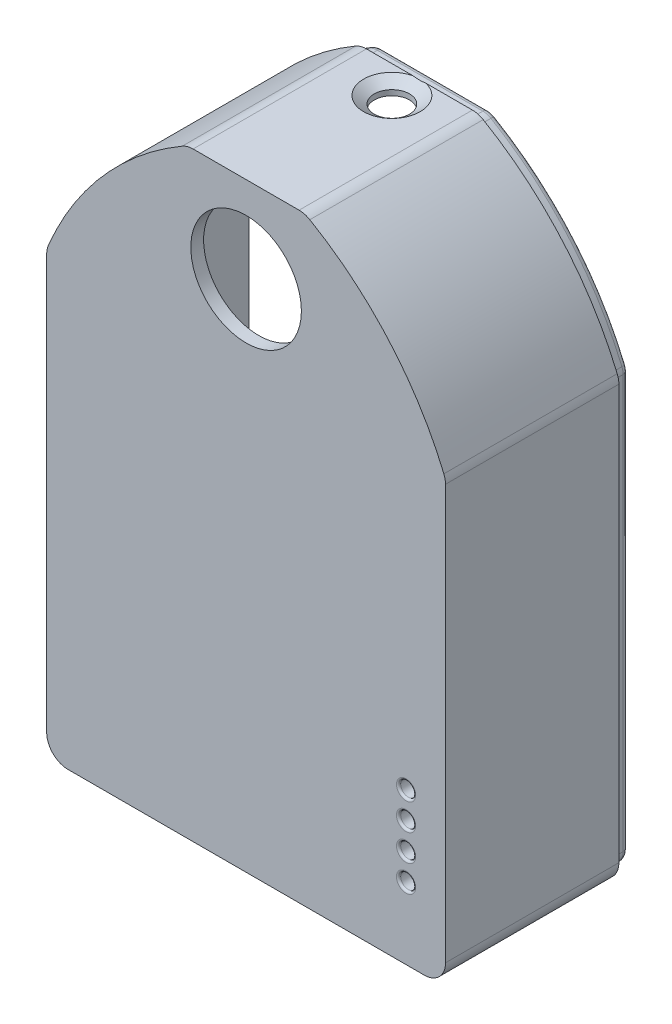
from build123d import *

# Parameters (mm, degrees)
SKETCH1_R             = 4.65
SKETCH1_R_2           = 1.85
EXTRUDE_THIN1_DEPTH   = 5
EXTRUDE_THIN1_2_DEPTH = 5
SKETCH1_R_3           = 3.9
SKETCH1_R_4           = 1.1
EXTRUDE_THIN1_3_DEPTH = 5
EXTRUDE_THIN1_4_DEPTH = 5
SKETCH3_R             = 4.65
SKETCH3_R_2           = 1.85
BOSS_EXTRUDE2_DEPTH   = 2.4
EXTRUDE_THIN2_START   = 30.11
EXTRUDE_THIN2_DEPTH   = 30.11
SKETCH5_R             = 10.368943179
CUT_EXTRUDE1_DEPTH    = 2.4
EXTRUDE_THIN3_START   = 3
EXTRUDE_THIN3_DEPTH   = 3
SKETCH7_W             = 9.762882659
SKETCH7_H             = 5.328585572
CUT_EXTRUDE2_DEPTH    = 2.4
SKETCH10_W            = 3.38269226
SKETCH10_H            = 1.73163863
SKETCH10_H_2          = 0.8
SKETCH10_H_3          = 1.731638631
CUT_EXTRUDE4_DEPTH    = 2.4
SKETCH11_R            = 1.4
CUT_EXTRUDE5_DEPTH    = 2.4
FILLET2_R             = 0.4
FILLET3_R             = 2
SKETCH12_R            = 3.3
CUT_EXTRUDE6_DEPTH    = 2.4
CHAMFER1_SIZE         = 2
CHAMFER1_SIZE_2       = 1.400415076
FILLET4_R             = 4
FILLET5_R             = 3
FILLET6_R             = 1


with BuildPart() as part:
    # Sketch1 → Extrude-Thin1 (new body)
    with BuildSketch(Plane.XY):
        with Locations((-22.941659, 27.553447)):
            Circle(SKETCH1_R)
        with Locations((-22.941659, 27.553447)):
            Circle(SKETCH1_R_2, mode=Mode.SUBTRACT)
    extrude(amount=EXTRUDE_THIN1_DEPTH)



with BuildPart() as body_2:
    # Sketch1 → Extrude-Thin1 2 (new body)
    with BuildSketch(Plane.XY):
        with Locations((-22.941659, -28.056553)):
            Circle(SKETCH1_R)
        with Locations((-22.941659, -28.056553)):
            Circle(SKETCH1_R_2, mode=Mode.SUBTRACT)
    extrude(amount=EXTRUDE_THIN1_2_DEPTH)


with BuildPart() as body_3:
    # Sketch1 → Extrude-Thin1 3 (new body)
    with BuildSketch(Plane.XY):
        with Locations((30, 35.5)):
            Circle(SKETCH1_R_3)
        with Locations((30, 35.5)):
            Circle(SKETCH1_R_4, mode=Mode.SUBTRACT)
    extrude(amount=EXTRUDE_THIN1_3_DEPTH)


with BuildPart() as body_4:
    # Sketch1 → Extrude-Thin1 4 (new body)
    with BuildSketch(Plane.XY):
        with Locations((30, -35.5)):
            Circle(SKETCH1_R_3)
        with Locations((30, -35.5)):
            Circle(SKETCH1_R_4, mode=Mode.SUBTRACT)
    extrude(amount=EXTRUDE_THIN1_4_DEPTH)


with BuildPart() as part_1:
    add(part.part)

    add(body_2.part)  # Boss-Extrude2 merges body 2

    add(body_3.part)  # Boss-Extrude2 merges body 3

    add(body_4.part)  # Boss-Extrude2 merges body 4
    # Sketch3 → Boss-Extrude2 (add)
    # profile 1 of 3: a face of its own
    with BuildSketch(Plane.XY.offset(5)):
        with BuildLine():
            Line((-37.4, 40.61), (-37.4, -41.9))
            Line((-37.4, -41.9), (37.4, -41.9))
            Line((37.4, -41.9), (37.4, 40.61))
            ThreePointArc((37.4, 40.61), (26.770998902, 57.872479034), (11, 70.61))
            Line((11, 70.61), (-11, 70.61))
            ThreePointArc((-11, 70.61), (-26.770998902, 57.872479034), (-37.4, 40.61))
        make_face()
        with Locations((-22.941659, 27.553447)):
            Circle(SKETCH3_R, mode=Mode.SUBTRACT)
    # profile 2 of 3: a face of its own
    with BuildSketch(Plane.XY.offset(5)):
        with Locations((-22.941659, 27.553447)):
            Circle(SKETCH3_R)
        with Locations((-22.941659, 27.553447)):
            Circle(SKETCH3_R_2, mode=Mode.SUBTRACT)
    # profile 3 of 3: a face of its own
    with BuildSketch(Plane.XY.offset(5)):
        with Locations((-22.941659, 27.553447)):
            Circle(SKETCH3_R_2)
    extrude(amount=BOSS_EXTRUDE2_DEPTH)

    # Sketch4 → Extrude-Thin2 (add)
    with BuildSketch(Plane(origin=(0, 0, 5), x_dir=(-1, 0, 0), z_dir=(0, 0, -1)).offset(EXTRUDE_THIN2_START)):
        with BuildLine():
            Line((-37.4, 40.61), (-37.4, -41.9))
            Line((-37.4, -41.9), (37.4, -41.9))
            Line((37.4, -41.9), (37.4, 40.61))
            ThreePointArc((37.4, 40.61), (26.770998902, 57.872479034), (11, 70.61))
            Line((11, 70.61), (-11, 70.61))
            ThreePointArc((-11, 70.61), (-26.770998902, 57.872479034), (-37.4, 40.61))
        make_face()
        with BuildLine():
            Line((-35, 40.140832689), (-35, -39.5))
            Line((-35, -39.5), (35, -39.5))
            Line((35, -39.5), (35, 40.140832689))
            ThreePointArc((35, 40.140832689), (25.021938672, 56.227056431), (10.36801887, 68.21))
            Line((10.36801887, 68.21), (-10.36801887, 68.21))
            ThreePointArc((-10.36801887, 68.21), (-25.021938672, 56.227056431), (-35, 40.140832689))
        make_face(mode=Mode.SUBTRACT)
    extrude(amount=-EXTRUDE_THIN2_DEPTH)

    # Sketch5 → Cut-Extrude1 (cut)
    with BuildSketch(Plane.XY.offset(7.4)):
        with Locations((0, 54.431088118)):
            Circle(SKETCH5_R)
    extrude(amount=-CUT_EXTRUDE1_DEPTH, mode=Mode.SUBTRACT)

    # Sketch6 → Extrude-Thin3 (add)
    with BuildSketch(Plane(origin=(0, 0, -25.11), x_dir=(-1, 0, 0), z_dir=(0, 0, -1)).offset(EXTRUDE_THIN3_START)):
        with BuildLine():
            Line((-10.685733563, 69.41), (10.685733563, 69.41))
            ThreePointArc((10.685733563, 69.41), (25.896594663, 57.049645838), (36.2, 40.376659037))
            Line((36.2, 40.376659037), (36.2, -40.7))
            Line((36.2, -40.7), (-36.2, -40.7))
            Line((-36.2, -40.7), (-36.2, 40.376659037))
            ThreePointArc((-36.2, 40.376659037), (-25.896594663, 57.049645838), (-10.685733563, 69.41))
        make_face()
        with BuildLine():
            Line((-10.36801887, 68.21), (10.36801887, 68.21))
            ThreePointArc((10.36801887, 68.21), (25.021938672, 56.227056431), (35, 40.140832689))
            Line((35, 40.140832689), (35, -39.5))
            Line((35, -39.5), (-35, -39.5))
            Line((-35, -39.5), (-35, 40.140832689))
            ThreePointArc((-35, 40.140832689), (-25.021938672, 56.227056431), (-10.36801887, 68.21))
        make_face(mode=Mode.SUBTRACT)
    extrude(amount=-EXTRUDE_THIN3_DEPTH)

    # Sketch7 → Cut-Extrude2 (cut)
    with BuildSketch(Plane.XZ.offset(41.9)):
        with Locations((-1.153377644, -4.974292786)):
            Rectangle(SKETCH7_W, SKETCH7_H)
        with BuildLine():
            Line((18, -0.615), (21.22, -0.615))
            ThreePointArc((21.22, -0.615), (22.669568901, -0.014568901), (23.27, 1.435))
            Line((23.27, 1.435), (23.27, 2.095))
            ThreePointArc((23.27, 2.095), (22.669568901, 3.544568901), (21.22, 4.145))
            Line((21.22, 4.145), (18, 4.145))
            Line((18, 4.145), (14.78, 4.145))
            ThreePointArc((14.78, 4.145), (13.330431099, 3.544568901), (12.73, 2.095))
            Line((12.73, 2.095), (12.73, 1.435))
            ThreePointArc((12.73, 1.435), (13.330431099, -0.014568901), (14.78, -0.615))
            Line((14.78, -0.615), (18, -0.615))
        make_face()
    extrude(amount=-CUT_EXTRUDE2_DEPTH, mode=Mode.SUBTRACT)

    # Sketch10 → Cut-Extrude4 (cut)
    with BuildSketch(Plane.ZY.offset(37.4)):
        with Locations((1.49365387, -0.852542054)):
            Rectangle(SKETCH10_W, SKETCH10_H)
        with Locations((1.49365387, -3.118361369)):
            Rectangle(SKETCH10_W, SKETCH10_H_2)
        with Locations((1.49365387, -3.918361369)):
            Rectangle(SKETCH10_W, SKETCH10_H_2)
        with Locations((1.49365387, -6.184180685)):
            Rectangle(SKETCH10_W, SKETCH10_H_3)
    extrude(amount=-CUT_EXTRUDE4_DEPTH, mode=Mode.SUBTRACT)

    # Sketch11 → Cut-Extrude5 (cut)
    with BuildSketch(Plane.XY.offset(7.4)):
        with Locations((30, -28.5)):
            Circle(SKETCH11_R)
        with Locations((30, -23.5)):
            Circle(SKETCH11_R)
        with Locations((30, -18.5)):
            Circle(SKETCH11_R)
        with Locations((30, -13.5)):
            Circle(SKETCH11_R)
    extrude(amount=-CUT_EXTRUDE5_DEPTH, mode=Mode.SUBTRACT)

    # Fillet2
    fillet2_edges = [part_1.edges().sort_by_distance(p)[0] for p in [
        (-37.4, -0.852542054, -0.19769226),
        (-36.2, -1.718361369, -0.19769226),
        (-37.4, 0.013277261, 1.49365387),
        (-36.2, 0.013277261, -0.19769226),
        (-35, -0.852542054, 3.185),
        (-36.2, 0.013277261, 3.185),
        (-35, -1.718361369, 1.49365387),
        (-36.2, -1.718361369, 3.185),
        (-35, -0.852542054, -0.19769226),
        (-35, 0.013277261, 1.49365387),
        (-37.4, -1.718361369, 1.49365387),
        (-37.4, -0.852542054, 3.185),
        (-37.4, -3.518361369, -0.19769226),
        (-36.2, -4.318361369, -0.19769226),
        (-37.4, -2.718361369, 1.49365387),
        (-36.2, -2.718361369, -0.19769226),
        (-35, -3.518361369, 3.185),
        (-36.2, -2.718361369, 3.185),
        (-35, -4.318361369, 1.49365387),
        (-36.2, -4.318361369, 3.185),
        (-35, -3.518361369, -0.19769226),
        (-35, -2.718361369, 1.49365387),
        (-37.4, -4.318361369, 1.49365387),
        (-37.4, -3.518361369, 3.185),
        (-37.4, -5.318361369, 1.49365387),
        (-36.2, -5.318361369, -0.19769226),
        (-35, -6.184180685, 3.185),
        (-36.2, -5.318361369, 3.185),
        (-35, -7.05, 1.49365387),
        (-36.2, -7.05, 3.185),
        (-37.4, -6.184180685, -0.19769226),
        (-36.2, -7.05, -0.19769226),
        (-35, -5.318361369, 1.49365387),
        (-35, -6.184180685, -0.19769226),
        (-37.4, -7.05, 1.49365387),
        (-37.4, -6.184180685, 3.185),
        (28.6, -28.5, 7.4),
        (28.6, -23.5, 7.4),
        (28.6, -18.5, 7.4),
        (28.6, -13.5, 7.4),
    ]]
    fillet(fillet2_edges, radius=FILLET2_R)

    # Fillet3
    fillet3_edges = [part_1.edges().sort_by_distance(p)[0] for p in [
        (-6.034818974, -41.9, -4.974292786),
        (-1.153377645, -41.9, -7.638585572),
        (3.728063685, -41.9, -4.974292786),
        (-1.153377645, -41.9, -2.31),
        (13.330431099, -41.9, -0.014568901),
        (18, -41.9, -0.615),
        (22.669568901, -41.9, -0.014568901),
        (23.27, -41.9, 1.765),
        (22.669568901, -41.9, 3.544568901),
        (18, -41.9, 4.145),
        (13.330431099, -41.9, 3.544568901),
        (12.73, -41.9, 1.765),
    ]]
    fillet(fillet3_edges, radius=FILLET3_R)

    # Sketch12 → Cut-Extrude6 (cut)
    with BuildSketch(Plane(origin=(0, 70.61, 0), x_dir=(1, 0, 0), z_dir=(0, 1, 0))):
        with Locations(Location((0, 19.945, 0), (0, 0, 180))):
            Circle(SKETCH12_R)
    extrude(amount=-CUT_EXTRUDE6_DEPTH, mode=Mode.SUBTRACT)

    # Chamfer1
    # the kernel refuses this chamfer: 2, 1.400415076 mm, written as the material it takes off along each edge
    with BuildSketch(Plane(origin=(0, 70.61, -19.945), x_dir=(-1, 0, 0), z_dir=(0, 0, -1))) as chamfer1_piece_1:
        Polygon((3.3 + CHAMFER1_SIZE, 0), (3.3, -CHAMFER1_SIZE_2), (3.3, 0), align=None)
    revolve(axis=Axis((0, 70.61, -19.945), (0, 1, 0)), mode=Mode.SUBTRACT)

    # Fillet4
    fillet4_edges = [part_1.edges().sort_by_distance(p)[0] for p in [
        (37.4, -41.9, -8.855),
        (37.4, 40.61, -8.855),
        (11, 70.61, -8.855),
        (-11, 70.61, -8.855),
        (-37.4, 40.61, -8.855),
        (-37.4, -41.9, -8.855),
    ]]
    fillet(fillet4_edges, radius=FILLET4_R)

    # Fillet5
    fillet5_edges = [part_1.edges().sort_by_distance(p)[0] for p in [
        (-36.2, -40.7, -26.61),
        (-36.2, 40.376659037, -26.61),
        (-10.685733563, 69.41, -26.61),
        (10.685733563, 69.41, -26.61),
        (36.2, 40.376659037, -26.61),
        (36.2, -40.7, -26.61),
    ]]
    fillet(fillet5_edges, radius=FILLET5_R)

    # Fillet6
    # the kernel refuses this fillet: 1 mm, written as the material it takes off along each edge
    with BuildSketch(Plane(origin=(18.271812113, 18.234805341, -28.11), x_dir=(-0.5045974511795549, 0.8633547430014481, 0), z_dir=(0.8633547430014481, 0.5045974511795549, 0))) as fillet6_piece_1:
        with BuildLine():
            CenterArc((58.8 - FILLET6_R, FILLET6_R), FILLET6_R, 270, 90)
            Line((58.8 - FILLET6_R, 0), (58.8, 0))
            Line((58.8, 0), (58.8, FILLET6_R))
        make_face()
    revolve(axis=Axis((18.271812113, 18.234805341, -28.11), (0, 0, 1)), revolution_arc=36.979903285, mode=Mode.SUBTRACT)
    with BuildSketch(Plane(origin=(-36.2, 39.782254326, -28.11), x_dir=(0, 0, 1), z_dir=(0, -1, 0)), Plane(origin=(36.2, -37.7, -28.11), x_dir=(0, 0, 1), z_dir=(0, 1, 0))) as fillet6_piece_2:
        with BuildLine():
            CenterArc((FILLET6_R, -FILLET6_R), FILLET6_R, 90, 90)
            Line((0, -FILLET6_R), (0, 0))
            Line((0, 0), (FILLET6_R, 0))
        make_face()
    extrude(amount=77.482254326, mode=Mode.SUBTRACT)
    with BuildSketch(Plane(origin=(9.884725663, 69.41, -28.11), x_dir=(0, 0, 1), z_dir=(-1, 0, 0))) as fillet6_piece_3:
        with BuildLine():
            CenterArc((FILLET6_R, -FILLET6_R), FILLET6_R, 90, 90)
            Line((0, -FILLET6_R), (0, 0))
            Line((0, 0), (FILLET6_R, 0))
        make_face()
    extrude(amount=19.769451326, mode=Mode.SUBTRACT)
    with BuildSketch(Plane(origin=(-18.271812113, 18.234805341, -28.11), x_dir=(0.9224339088359568, 0.386154999747016, 0), z_dir=(0.386154999747016, -0.9224339088359568, 0))) as fillet6_piece_4:
        with BuildLine():
            CenterArc((58.8 - FILLET6_R, FILLET6_R), FILLET6_R, 270, 90)
            Line((58.8 - FILLET6_R, 0), (58.8, 0))
            Line((58.8, 0), (58.8, FILLET6_R))
        make_face()
    revolve(axis=Axis((-18.271812113, 18.234805341, -28.11), (0, 0, 1)), revolution_arc=36.979903285, mode=Mode.SUBTRACT)
    with BuildSketch(Plane(origin=(-33.2, -40.7, -28.11), x_dir=(0, 0, 1), z_dir=(1, 0, 0))) as fillet6_piece_5:
        with BuildLine():
            CenterArc((FILLET6_R, -FILLET6_R), FILLET6_R, 90, 90)
            Line((0, -FILLET6_R), (0, 0))
            Line((0, 0), (FILLET6_R, 0))
        make_face()
    extrude(amount=66.4, mode=Mode.SUBTRACT)
    with BuildSketch(Plane(origin=(33.2, -37.7, -28.11), x_dir=(1, 0, 0), z_dir=(0, 1, 0))) as fillet6_piece_6:
        with BuildLine():
            CenterArc((3 - FILLET6_R, -FILLET6_R), FILLET6_R, 0, 90)
            Line((3 - FILLET6_R, 0), (3, 0))
            Line((3, 0), (3, -FILLET6_R))
        make_face()
    revolve(axis=Axis((33.2, -37.7, -28.11), (0, 0, -1)), revolution_arc=90, mode=Mode.SUBTRACT)
    with BuildSketch(Plane(origin=(-33.2, -37.7, -28.11), x_dir=(0, -1, 0), z_dir=(1, 0, 0))) as fillet6_piece_7:
        with BuildLine():
            CenterArc((3 - FILLET6_R, -FILLET6_R), FILLET6_R, 0, 90)
            Line((3 - FILLET6_R, 0), (3, 0))
            Line((3, 0), (3, -FILLET6_R))
        make_face()
    revolve(axis=Axis((-33.2, -37.7, -28.11), (0, 0, -1)), revolution_arc=90, mode=Mode.SUBTRACT)
    with BuildSketch(Plane(origin=(33.2, 39.782254326, -28.11), x_dir=(0.9224339088359567, 0.3861549997470163, 0), z_dir=(-0.3861549997470163, 0.9224339088359567, 0))) as fillet6_piece_8:
        with BuildLine():
            CenterArc((3 - FILLET6_R, -FILLET6_R), FILLET6_R, 0, 90)
            Line((3 - FILLET6_R, 0), (3, 0))
            Line((3, 0), (3, -FILLET6_R))
        make_face()
    revolve(axis=Axis((33.2, 39.782254326, -28.11), (0, 0, -1)), revolution_arc=22.715462792, mode=Mode.SUBTRACT)
    with BuildSketch(Plane(origin=(9.884725663, 66.41, -28.11), x_dir=(0.5045974511795543, 0.8633547430014485, 0), z_dir=(0.8633547430014485, -0.5045974511795543, 0))) as fillet6_piece_9:
        with BuildLine():
            CenterArc((3 - FILLET6_R, FILLET6_R), FILLET6_R, 270, 90)
            Line((3 - FILLET6_R, 0), (3, 0))
            Line((3, 0), (3, FILLET6_R))
        make_face()
    revolve(axis=Axis((9.884725663, 66.41, -28.11), (0, 0, 1)), revolution_arc=30.304633922, mode=Mode.SUBTRACT)
    with BuildSketch(Plane(origin=(-9.884725663, 66.41, -28.11), x_dir=(0, 1, 0), z_dir=(1, 0, 0))) as fillet6_piece_10:
        with BuildLine():
            CenterArc((3 - FILLET6_R, FILLET6_R), FILLET6_R, 270, 90)
            Line((3 - FILLET6_R, 0), (3, 0))
            Line((3, 0), (3, FILLET6_R))
        make_face()
    revolve(axis=Axis((-9.884725663, 66.41, -28.11), (0, 0, 1)), revolution_arc=30.304633922, mode=Mode.SUBTRACT)
    with BuildSketch(Plane(origin=(-33.2, 39.782254326, -28.11), x_dir=(-0.9224339088359567, 0.3861549997470163, 0), z_dir=(0.3861549997470163, 0.9224339088359567, 0))) as fillet6_piece_11:
        with BuildLine():
            CenterArc((3 - FILLET6_R, FILLET6_R), FILLET6_R, 270, 90)
            Line((3 - FILLET6_R, 0), (3, 0))
            Line((3, 0), (3, FILLET6_R))
        make_face()
    revolve(axis=Axis((-33.2, 39.782254326, -28.11), (0, 0, 1)), revolution_arc=22.715462792, mode=Mode.SUBTRACT)


solid = part_1.part
